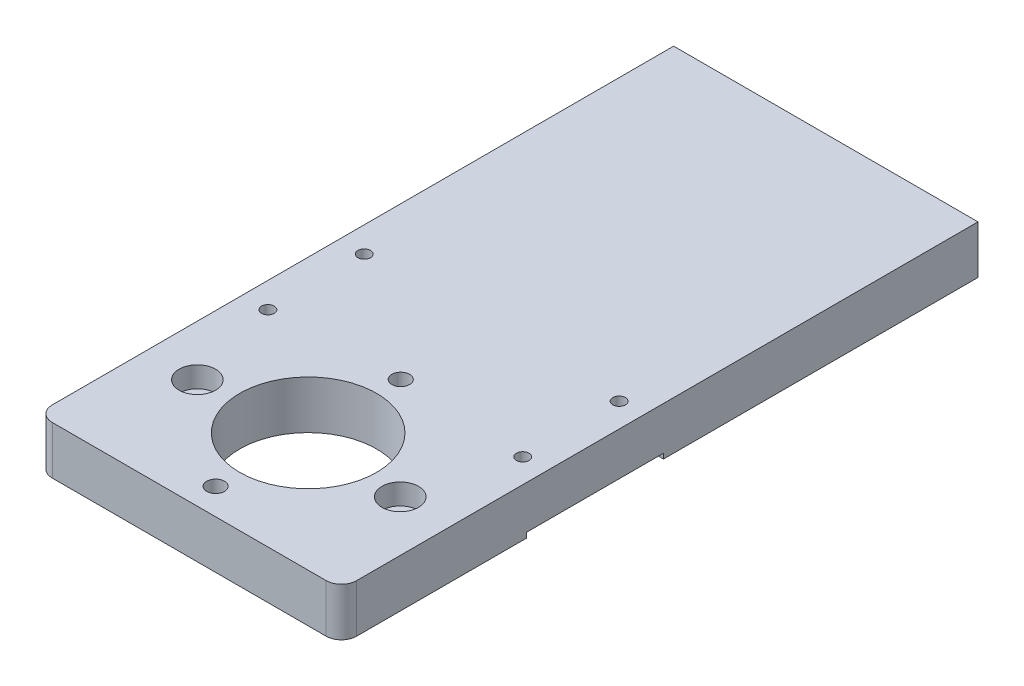
from build123d import *

# Parameters (mm, degrees)
SKETCH_1_W          = 60
SKETCH_1_H          = 63.5
EXTRUDE_1_DEPTH     = 9.5
FILLET_1_R          = 3
SKETCH_3_R          = 13.5
CUT_EXTRUDE_2_DEPTH = 45.702488745
CUT_EXTRUDE_3_DEPTH = 1
SKETCH_5_R          = 1.25
CUT_EXTRUDE_4_DEPTH = 45.702488745
SKETCH_7_R          = 4
CUT_EXTRUDE_6_DEPTH = 1
SKETCH_8_R          = 2
CUT_EXTRUDE_7_DEPTH = 45.702488745
SKETCH_9_R          = 3.6
CUT_EXTRUDE_8_DEPTH = 4.1
SKETCH_10_R         = 1.75
CUT_EXTRUDE_9_DEPTH = 45.702488745
SKETCH_11_W         = 60
SKETCH_11_H         = 62
EXTRUDE_2_DEPTH     = 9.5


with BuildPart() as part:
    # 草图1 → 凸台-拉伸1 (new body)
    with BuildSketch(Plane(origin=(0, 0, 0), x_dir=(1, 0, 0), z_dir=(0, 1, 0))):
        Rectangle(SKETCH_1_W, SKETCH_1_H)
    extrude(amount=EXTRUDE_1_DEPTH)

    # 圆角1
    fillet_1_edges = [part.edges().sort_by_distance(p)[0] for p in [
        (30, 4.75, 31.75),
        (-30, 4.75, 31.75),
    ]]
    fillet(fillet_1_edges, radius=FILLET_1_R)

    # 草图3 → 切除-拉伸2 (cut, through all)
    with BuildSketch(Plane(origin=(0, 9.5, 0), x_dir=(1, 0, 0), z_dir=(0, 1, 0))):
        with Locations((0, -8.302922201)):
            Circle(SKETCH_3_R)
    extrude(amount=-CUT_EXTRUDE_2_DEPTH, mode=Mode.SUBTRACT)

    # 草图4 → 切除-拉伸3 (cut)
    with BuildSketch(Plane.XZ):
        with BuildLine():
            Line((20.5, -4.75), (30, -4.75))
            Line((30, -4.75), (30, -31.75))
            Line((30, -31.75), (20.5, -31.75))
            Line((20.5, -31.75), (20.5, -7.25))
            ThreePointArc((20.5, -7.25), (19.25, -6), (20.5, -4.75))
        make_face()
        with BuildLine():
            Line((-20.5, -4.75), (-30, -4.75))
            Line((-30, -4.75), (-30, -31.75))
            Line((-30, -31.75), (-20.5, -31.75))
            Line((-20.5, -31.75), (-20.5, -7.25))
            ThreePointArc((-20.5, -7.25), (-19.25, -6), (-20.5, -4.75))
        make_face()
    extrude(amount=-CUT_EXTRUDE_3_DEPTH, mode=Mode.SUBTRACT)

    # 草图5 → 切除-拉伸4 (cut, through all)
    with BuildSketch(Plane(origin=(0, 9.5, 0), x_dir=(1, 0, 0), z_dir=(0, 1, 0))):
        with Locations((25.25, 27.75)):
            Circle(SKETCH_5_R)
        with Locations((25.25, 8.75)):
            Circle(SKETCH_5_R)
        with Locations((-25, 27.75)):
            Circle(SKETCH_5_R)
        with Locations((-25, 8.75)):
            Circle(SKETCH_5_R)
    extrude(amount=-CUT_EXTRUDE_4_DEPTH, mode=Mode.SUBTRACT)

    # 草图7 → 切除-拉伸6 (cut)
    with BuildSketch(Plane.XZ):
        with Locations((-20, 10.15)):
            Circle(SKETCH_7_R)
        with Locations((20, 10.15)):
            Circle(SKETCH_7_R)
    extrude(amount=-CUT_EXTRUDE_6_DEPTH, mode=Mode.SUBTRACT)

    # 草图8 → 切除-拉伸7 (cut, through all)
    with BuildSketch(Plane(origin=(0, 9.5, 0), x_dir=(1, 0, 0), z_dir=(0, 1, 0))):
        with Locations((-20, -10.15)):
            Circle(SKETCH_8_R)
        with Locations((20, -10.15)):
            Circle(SKETCH_8_R)
    extrude(amount=-CUT_EXTRUDE_7_DEPTH, mode=Mode.SUBTRACT)

    # 草图9 → 切除-拉伸8 (cut)
    with BuildSketch(Plane(origin=(0, 9.5, 0), x_dir=(1, 0, 0), z_dir=(0, 1, 0))):
        with Locations((-20, -10.15)):
            Circle(SKETCH_9_R)
        with Locations((20, -10.15)):
            Circle(SKETCH_9_R)
    extrude(amount=-CUT_EXTRUDE_8_DEPTH, mode=Mode.SUBTRACT)

    # 草图10 → 切除-拉伸9 (cut, through all)
    with BuildSketch(Plane(origin=(0, 9.5, 0), x_dir=(1, 0, 0), z_dir=(0, 1, 0))):
        with Locations((0, 9.947077799)):
            Circle(SKETCH_10_R)
        with Locations((0, -26.552922201)):
            Circle(SKETCH_10_R)
    extrude(amount=-CUT_EXTRUDE_9_DEPTH, mode=Mode.SUBTRACT)

    # 草图11 → 凸台-拉伸2 (add)
    with BuildSketch(Plane(origin=(0, 9.5, 0), x_dir=(1, 0, 0), z_dir=(0, 1, 0))):
        with Locations((0, 62.75)):
            Rectangle(SKETCH_11_W, SKETCH_11_H)
    extrude(amount=-EXTRUDE_2_DEPTH)


solid = part.part
